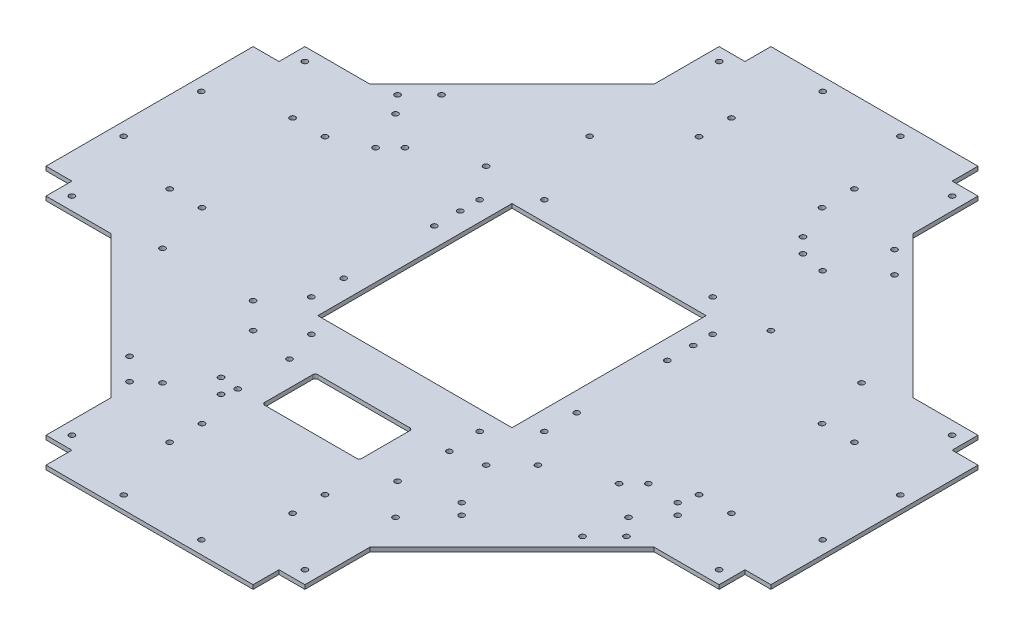
from build123d import *

# Parameters (mm, degrees)
SKETCH1_R           = 2.125
BOSS_EXTRUDE1_DEPTH = 3.175
SKETCH2_R           = 2.125
SKETCH2_R_2         = 2.1
SKETCH2_W           = 150
SKETCH2_H           = 150
SKETCH2_W_2         = 75
SKETCH2_H_2         = 41
CUT_EXTRUDE1_DEPTH  = 396.992525971
FILLET1_R           = 2
SKETCH3_W           = 20
SKETCH3_H           = 20
CUT_EXTRUDE2_DEPTH  = 396.992525971


with BuildPart() as part:
    # Sketch1 → Boss-Extrude1 (new body)
    with BuildSketch(Plane(origin=(0, 0, 0), x_dir=(1, 0, 0), z_dir=(0, 1, 0))):
        Polygon((-100, -280), (0, -280), (100, -280), (100, -209.601551084), (209.601551084, -100), (280, -100), (280, 0), (280, 100), (209.601551084, 100), (100, 209.601551084), (100, 280), (0, 280), (-100, 280), (-100, 209.601551084), (-209.601551084, 100), (-280, 100), (-280, 0), (-280, -100), (-209.601551084, -100), (-100, -209.601551084), align=None)
        with Locations((-90, -270)):
            Circle(SKETCH1_R, mode=Mode.SUBTRACT)
        with Locations((-90, -250)):
            Circle(SKETCH1_R, mode=Mode.SUBTRACT)
        with Locations((-30, -270)):
            Circle(SKETCH1_R, mode=Mode.SUBTRACT)
        with Locations((-47.5, -217)):
            Circle(SKETCH1_R, mode=Mode.SUBTRACT)
        with Locations((-90, -180)):
            Circle(SKETCH1_R, mode=Mode.SUBTRACT)
        with Locations((-47.5, -192)):
            Circle(SKETCH1_R, mode=Mode.SUBTRACT)
        with Locations((-270, -90)):
            Circle(SKETCH1_R, mode=Mode.SUBTRACT)
        with Locations((-250, -90)):
            Circle(SKETCH1_R, mode=Mode.SUBTRACT)
        with Locations((-180, -90)):
            Circle(SKETCH1_R, mode=Mode.SUBTRACT)
        with Locations((-217, -47.5)):
            Circle(SKETCH1_R, mode=Mode.SUBTRACT)
        with Locations((-270, -30)):
            Circle(SKETCH1_R, mode=Mode.SUBTRACT)
        with Locations((-192, -47.5)):
            Circle(SKETCH1_R, mode=Mode.SUBTRACT)
        with Locations((-90, -110)):
            Circle(SKETCH1_R, mode=Mode.SUBTRACT)
        with Locations((-110, -90)):
            Circle(SKETCH1_R, mode=Mode.SUBTRACT)
        with Locations((-90, -40)):
            Circle(SKETCH1_R, mode=Mode.SUBTRACT)
        with Locations((30, -270)):
            Circle(SKETCH1_R, mode=Mode.SUBTRACT)
        with Locations((47.5, -217)):
            Circle(SKETCH1_R, mode=Mode.SUBTRACT)
        with Locations((90, -270)):
            Circle(SKETCH1_R, mode=Mode.SUBTRACT)
        with Locations((90, -250)):
            Circle(SKETCH1_R, mode=Mode.SUBTRACT)
        with Locations((47.5, -192)):
            Circle(SKETCH1_R, mode=Mode.SUBTRACT)
        with Locations((90, -180)):
            Circle(SKETCH1_R, mode=Mode.SUBTRACT)
        with Locations((90, -110)):
            Circle(SKETCH1_R, mode=Mode.SUBTRACT)
        with Locations((110, -90)):
            Circle(SKETCH1_R, mode=Mode.SUBTRACT)
        with Locations((90, -40)):
            Circle(SKETCH1_R, mode=Mode.SUBTRACT)
        with Locations((180, -90)):
            Circle(SKETCH1_R, mode=Mode.SUBTRACT)
        with Locations((250, -90)):
            Circle(SKETCH1_R, mode=Mode.SUBTRACT)
        with Locations((270, -90)):
            Circle(SKETCH1_R, mode=Mode.SUBTRACT)
        with Locations((192, -47.5)):
            Circle(SKETCH1_R, mode=Mode.SUBTRACT)
        with Locations((217, -47.5)):
            Circle(SKETCH1_R, mode=Mode.SUBTRACT)
        with Locations((270, -30)):
            Circle(SKETCH1_R, mode=Mode.SUBTRACT)
        with Locations((-270, 30)):
            Circle(SKETCH1_R, mode=Mode.SUBTRACT)
        with Locations((-217, 47.5)):
            Circle(SKETCH1_R, mode=Mode.SUBTRACT)
        with Locations((-192, 47.5)):
            Circle(SKETCH1_R, mode=Mode.SUBTRACT)
        with Locations((-270, 90)):
            Circle(SKETCH1_R, mode=Mode.SUBTRACT)
        with Locations((-250, 90)):
            Circle(SKETCH1_R, mode=Mode.SUBTRACT)
        with Locations((-180, 90)):
            Circle(SKETCH1_R, mode=Mode.SUBTRACT)
        with Locations((-90, 30)):
            Circle(SKETCH1_R, mode=Mode.SUBTRACT)
        with Locations((-90, 50)):
            Circle(SKETCH1_R, mode=Mode.SUBTRACT)
        with Locations((-110, 90)):
            Circle(SKETCH1_R, mode=Mode.SUBTRACT)
        with Locations((-90, 150)):
            Circle(SKETCH1_R, mode=Mode.SUBTRACT)
        with Locations((-47.5, 192)):
            Circle(SKETCH1_R, mode=Mode.SUBTRACT)
        with Locations((-90, 250)):
            Circle(SKETCH1_R, mode=Mode.SUBTRACT)
        with Locations((-90, 270)):
            Circle(SKETCH1_R, mode=Mode.SUBTRACT)
        with Locations((-47.5, 217)):
            Circle(SKETCH1_R, mode=Mode.SUBTRACT)
        with Locations((-30, 270)):
            Circle(SKETCH1_R, mode=Mode.SUBTRACT)
        with Locations((90, 30)):
            Circle(SKETCH1_R, mode=Mode.SUBTRACT)
        with Locations((90, 50)):
            Circle(SKETCH1_R, mode=Mode.SUBTRACT)
        with Locations((110, 90)):
            Circle(SKETCH1_R, mode=Mode.SUBTRACT)
        with Locations((192, 47.5)):
            Circle(SKETCH1_R, mode=Mode.SUBTRACT)
        with Locations((270, 30)):
            Circle(SKETCH1_R, mode=Mode.SUBTRACT)
        with Locations((217, 47.5)):
            Circle(SKETCH1_R, mode=Mode.SUBTRACT)
        with Locations((180, 90)):
            Circle(SKETCH1_R, mode=Mode.SUBTRACT)
        with Locations((250, 90)):
            Circle(SKETCH1_R, mode=Mode.SUBTRACT)
        with Locations((270, 90)):
            Circle(SKETCH1_R, mode=Mode.SUBTRACT)
        with Locations((47.5, 192)):
            Circle(SKETCH1_R, mode=Mode.SUBTRACT)
        with Locations((90, 150)):
            Circle(SKETCH1_R, mode=Mode.SUBTRACT)
        with Locations((47.5, 217)):
            Circle(SKETCH1_R, mode=Mode.SUBTRACT)
        with Locations((30, 270)):
            Circle(SKETCH1_R, mode=Mode.SUBTRACT)
        with Locations((90, 250)):
            Circle(SKETCH1_R, mode=Mode.SUBTRACT)
        with Locations((90, 270)):
            Circle(SKETCH1_R, mode=Mode.SUBTRACT)
    extrude(amount=BOSS_EXTRUDE1_DEPTH)

    # Sketch2 → Cut-Extrude1 (cut, through all)
    with BuildSketch(Plane(origin=(0, 3.175, 0), x_dir=(1, 0, 0), z_dir=(0, 1, 0))):
        with Locations((66.6, -115)):
            Circle(SKETCH2_R)
        with Locations((-90, 65)):
            Circle(SKETCH2_R)
        with Locations((-90, -65)):
            Circle(SKETCH2_R)
        with Locations((90, -65)):
            Circle(SKETCH2_R)
        with Locations((90, 65)):
            Circle(SKETCH2_R)
        with Locations((-65, 90)):
            Circle(SKETCH2_R)
        with Locations((65, 90)):
            Circle(SKETCH2_R)
        with Locations((65, -90)):
            Circle(SKETCH2_R)
        with Locations((-65, -90)):
            Circle(SKETCH2_R)
        with Locations((66.6, -155)):
            Circle(SKETCH2_R)
        with Locations((-56.9, -115)):
            Circle(SKETCH2_R_2)
        with Locations((-56.9, -155)):
            Circle(SKETCH2_R_2)
        with Locations((174.953318806, -120.506096654)):
            Circle(SKETCH2_R)
        with Locations((191.923881554, -103.535533906)):
            Circle(SKETCH2_R)
        with Locations((153.736977236, -71.011760106)):
            Circle(SKETCH2_R)
        with Locations((165.050685735, -59.698051607)):
            Circle(SKETCH2_R)
        with Locations((-120.506096654, -174.953318806)):
            Circle(SKETCH2_R)
        with Locations((-103.535533906, -191.923881554)):
            Circle(SKETCH2_R)
        with Locations((-71.011760106, -153.736977236)):
            Circle(SKETCH2_R)
        with Locations((-59.698051607, -165.050685735)):
            Circle(SKETCH2_R)
        with Locations((-174.953318806, 120.506096654)):
            Circle(SKETCH2_R)
        with Locations((-191.923881554, 103.535533906)):
            Circle(SKETCH2_R)
        with Locations((-153.736977236, 71.011760106)):
            Circle(SKETCH2_R)
        with Locations((-165.050685735, 59.698051607)):
            Circle(SKETCH2_R)
        with Locations((120.506096654, 174.953318806)):
            Circle(SKETCH2_R)
        with Locations((103.535533906, 191.923881554)):
            Circle(SKETCH2_R)
        with Locations((71.011760106, 153.736977236)):
            Circle(SKETCH2_R)
        with Locations((59.698051607, 165.050685735)):
            Circle(SKETCH2_R)
        with Locations((114.142135624, -153.033008589)):
            Circle(SKETCH2_R)
        with Locations((105.656854249, -144.547727215)):
            Circle(SKETCH2_R_2)
        with Locations((197.580735804, -69.594408409)):
            Circle(SKETCH2_R)
        with Locations((189.09545443, -61.109127035)):
            Circle(SKETCH2_R_2)
        Rectangle(SKETCH2_W, SKETCH2_H)
        with Locations((0, -135)):
            Rectangle(SKETCH2_W_2, SKETCH2_H_2)
    extrude(amount=-CUT_EXTRUDE1_DEPTH, mode=Mode.SUBTRACT)

    # Fillet1
    fillet1_edges = [part.edges().sort_by_distance(p)[0] for p in [
        (-37.5, 1.5875, 155.5),
        (37.5, 1.5875, 155.5),
        (37.5, 1.5875, 114.5),
        (-37.5, 1.5875, 114.5),
    ]]
    fillet(fillet1_edges, radius=FILLET1_R)

    # Sketch3 → Cut-Extrude2 (cut, through all)
    with BuildSketch(Plane(origin=(0, 3.175, 0), x_dir=(1, 0, 0), z_dir=(0, 1, 0))):
        with Locations((-270, 90)):
            Rectangle(SKETCH3_W, SKETCH3_H)
        with Locations((90, -270)):
            Rectangle(SKETCH3_W, SKETCH3_H)
        with Locations((-90, -270)):
            Rectangle(SKETCH3_W, SKETCH3_H)
        with Locations((-270, -90)):
            Rectangle(SKETCH3_W, SKETCH3_H)
        with Locations((90, 270)):
            Rectangle(SKETCH3_W, SKETCH3_H)
        with Locations((-90, 270)):
            Rectangle(SKETCH3_W, SKETCH3_H)
        with Locations((270, -90)):
            Rectangle(SKETCH3_W, SKETCH3_H)
        with Locations((270, 90)):
            Rectangle(SKETCH3_W, SKETCH3_H)
    extrude(amount=-CUT_EXTRUDE2_DEPTH, mode=Mode.SUBTRACT)


solid = part.part
